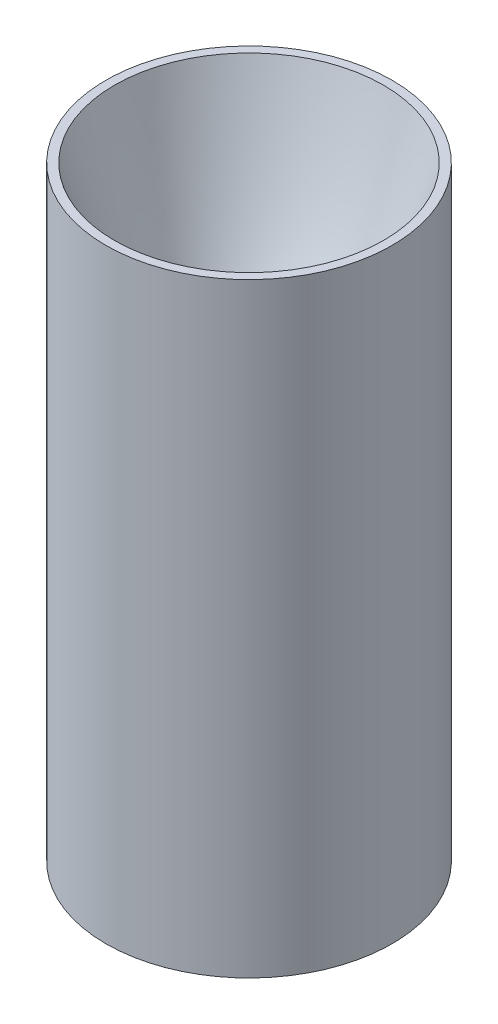
from build123d import *

# Parameters (mm, degrees)
CIRPATTERN1_COUNT              = 8
F_1_4_0_2500_DOWEL_HOLE1_D     = 6.35
F_1_4_0_2500_DOWEL_HOLE1_DEPTH = 9.906
F_1_4_0_2500_DOWEL_HOLE1_TIP   = 1.907732465


with BuildPart() as part:
    # Sketch1 → Revolve2 (revolve)
    with BuildSketch(Plane.XY):
        with BuildLine():
            Line((71.638455479, 109.927347077), (76.2, 109.927347077))
            Line((76.2, 109.927347077), (76.2, -212.127673762))
            Line((76.2, -212.127673762), (53.792460107, -212.127673762))
            Line((53.792460107, -212.127673762), (53.792460107, -59.727673762))
            add(Edge.make_bspline(
                [(53.792460107, -59.727673762), (53.792458875, -59.657143693), (53.79192973, -59.515566639), (53.789553877, -59.181725153), (53.783229275, -58.904956029), (53.773743784, -58.532728024), (53.761100883, -58.212998158), (53.741350051, -57.781754979), (53.711337705, -57.281120436), (53.667125535, -56.688158703), (53.588220857, -55.848640904), (53.488359258, -55.0083264), (53.367608174, -54.172595971), (53.197743199, -53.172585782), (53.002996554, -52.177603366), (52.777307477, -51.18869963), (52.520946571, -50.207649587), (52.240221677, -49.233238292), (51.935281065, -48.266129779), (51.544470146, -47.149295627), (51.050452662, -45.89056897), (50.509666041, -44.651129374), (49.922993204, -43.432862102), (49.291052494, -42.237253822), (48.61505748, -41.066315469), (47.895407759, -39.921133254), (47.134034366, -38.804236844), (46.430801278, -37.851612398), (45.804470147, -37.055832742), (45.263749884, -36.403541907), (44.826059146, -35.894408262), (44.425708383, -35.447153291), (44.092389692, -35.084791822), (43.78485681, -34.760500791), (43.58500459, -34.551710093), (43.355324254, -34.318676932), (43.254715332, -34.217322701), (43.204843184, -34.167450314)],
                knots=[0.082637729, 0.082637729, 0.082637729, 0.082637729, 0.082637729, 0.092574926, 0.102512123, 0.11244932, 0.122386517, 0.132323714, 0.142260911, 0.162135305, 0.182009699, 0.201884093, 0.24163288, 0.261507274, 0.281381668, 0.321130456, 0.360879243, 0.380753637, 0.400628031, 0.440376819, 0.480125606, 0.519874394, 0.559623181, 0.599371969, 0.639120757, 0.678869544, 0.718618332, 0.75836712, 0.798115907, 0.817990301, 0.837864695, 0.857739089, 0.877613483, 0.88755068, 0.897487877, 0.907425074, 0.91736227, 0.91736227, 0.91736227, 0.91736227, 0.91736227], degree=4))
            Line((43.204843184, -34.167450314), (34.597214986, -25.559822117))
            add(Edge.make_bspline(
                [(24.01, 0), (24.010001231, -0.070528647), (24.010530378, -0.21358419), (24.012906064, -0.543182916), (24.019230459, -0.824160397), (24.02871558, -1.194822071), (24.041357874, -1.513435058), (24.057158098, -1.861939603), (24.076113357, -2.193706871), (24.103750972, -2.6180694), (24.14321918, -3.122033947), (24.214231842, -3.879978675), (24.334058815, -4.886450388), (24.510418183, -6.05671076), (24.761817375, -7.385166415), (25.062727459, -8.703574514), (25.412702772, -10.009637209), (25.811293135, -11.301819597), (26.257877546, -12.578099335), (26.75193548, -13.836887484), (27.292605281, -15.076197129), (27.879411549, -16.294609794), (28.511071563, -17.489938794), (29.187464564, -18.661287757), (29.906377272, -19.805743397), (30.668954172, -20.923860075), (31.370099368, -21.87441176), (31.9996683, -22.673445481), (32.535060595, -23.320422138), (32.983187947, -23.840005017), (33.419382207, -24.329816247), (33.846758303, -24.78848439), (34.156490822, -25.113868311), (34.44779214, -25.409649047), (34.547344609, -25.509949933), (34.597214986, -25.559822117)],
                knots=[0.082637729, 0.082637729, 0.082637729, 0.082637729, 0.082637729, 0.092574926, 0.102512123, 0.11244932, 0.122386517, 0.132323714, 0.142260911, 0.152198108, 0.162135305, 0.182009699, 0.201884093, 0.24163288, 0.281381668, 0.321130456, 0.360879243, 0.400628031, 0.440376819, 0.480125606, 0.519874394, 0.559623181, 0.599371969, 0.639120757, 0.678869544, 0.718618332, 0.75836712, 0.798115907, 0.817990301, 0.837864695, 0.857739089, 0.877613483, 0.897487877, 0.907425074, 0.91736227, 0.91736227, 0.91736227, 0.91736227, 0.91736227], degree=4))
            add(Edge.make_bspline(
                [(24.01, 0), (24.010000626, 0.035892652), (24.010538457, 0.11011369), (24.012955849, 0.267641069), (24.019393694, 0.427064117), (24.031465725, 0.646764266), (24.052367213, 0.901433328), (24.086116845, 1.202537273), (24.137431431, 1.542050498), (24.201475827, 1.880996777), (24.278073727, 2.21635442), (24.367255697, 2.549239421), (24.468673539, 2.878092645), (24.582551197, 3.203347041), (24.708128897, 3.523627157), (24.846218103, 3.839666733), (24.995002427, 4.149282184), (25.156944348, 4.454783123), (25.327420631, 4.751301575), (25.513446847, 5.045703861), (25.702720396, 5.325518936), (25.9153376, 5.610727543), (26.0898085, 5.832913647), (26.277277882, 6.049951637), (26.415487374, 6.208641646), (26.581374196, 6.382121779), (26.655452387, 6.458478841), (26.706211329, 6.50923965)],
                knots=[0.082568816, 0.082568816, 0.082568816, 0.082568816, 0.082568816, 0.102426634, 0.122284453, 0.142142271, 0.162000089, 0.201715725, 0.241431362, 0.281146998, 0.320862634, 0.360578271, 0.400293907, 0.440009544, 0.47972518, 0.519440816, 0.559156453, 0.598872089, 0.638587725, 0.678303362, 0.718018998, 0.757734635, 0.797450271, 0.837165907, 0.857023726, 0.876881544, 0.91659718, 0.91659718, 0.91659718, 0.91659718, 0.91659718], degree=4))
            add(Edge.make_bspline(
                [(26.706211329, 6.50923965), (49.172333461, 34.635954224), (71.638455479, 109.927347077)],
                knots=[0, 0, 0, 1, 1, 1], degree=2))
        make_face()
    revolve(axis=Axis((0, 0, 0), (0, -1, 0)))

    # Sketch4 → 3/8-24 Tapped Hole1 (revolve, cut)
    with BuildSketch(Plane(origin=(66.675, -212.127673762, 0), x_dir=(0, 0, -1), z_dir=(1, 0, 0))):
        Polygon((0, 0), (0, 27.534688714), (4.2164, 25.00122), (4.2164, 0), align=None)
    f_3_8_24_tapped_hole1 = revolve(axis=Axis((66.675, -218.477673762, 0), (0, 1, 0)), mode=Mode.SUBTRACT)

    # CirPattern1: 3/8-24 Tapped Hole1 ×8 about axis
    cirpattern1_axis = Axis((0, 0, 0), (0, -1, 0))
    for i in range(1, CIRPATTERN1_COUNT):
        add(f_3_8_24_tapped_hole1.rotate(cirpattern1_axis, i * 360 / CIRPATTERN1_COUNT), mode=Mode.SUBTRACT)

    # 1/4 (0.2500) Dowel Hole1
    with Locations(Plane(origin=(0, -212.127673762, 0), x_dir=(-1, 0, 0), z_dir=(0, -1, 0))):
        with Locations((-61.59966783, 25.515417853), (61.59966783, -25.515417853)):
            Hole(F_1_4_0_2500_DOWEL_HOLE1_D / 2, depth=F_1_4_0_2500_DOWEL_HOLE1_DEPTH)
            with Locations((0, 0, -(F_1_4_0_2500_DOWEL_HOLE1_DEPTH + F_1_4_0_2500_DOWEL_HOLE1_TIP / 2))):  # 118° drill point
                Cone(0, F_1_4_0_2500_DOWEL_HOLE1_D / 2, F_1_4_0_2500_DOWEL_HOLE1_TIP, mode=Mode.SUBTRACT)


solid = part.part
